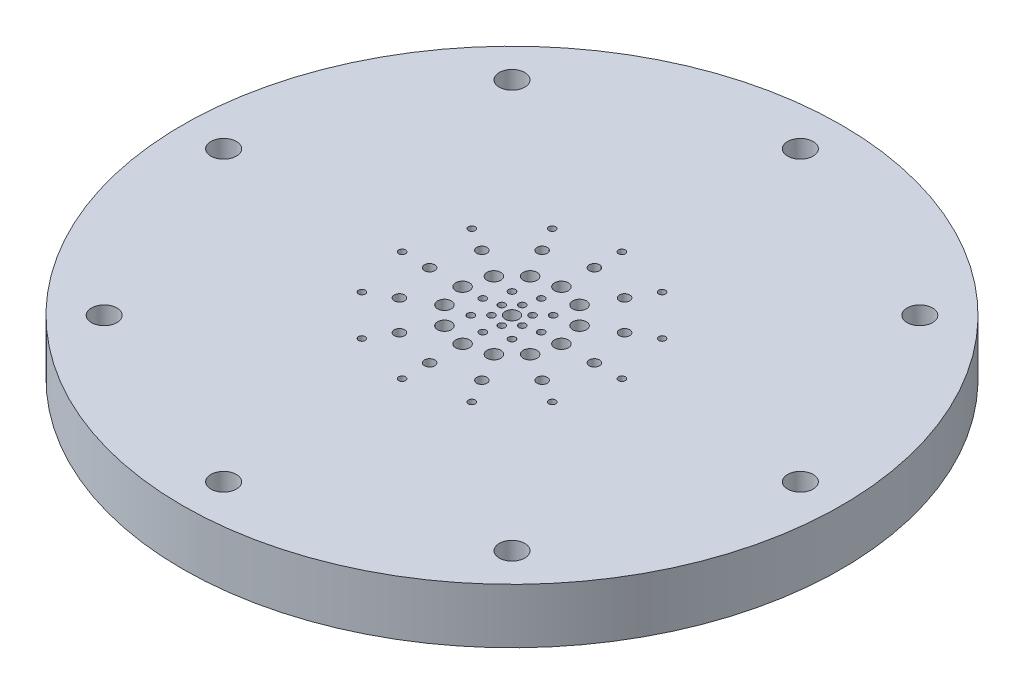
from build123d import *

# Parameters (mm, degrees)
SKETCH1_R                                      = 38.1
BOSS_EXTRUDE1_DEPTH                            = 6.35
CBORE_FOR_4_BUTTON_HEAD_CAP_SCREW1_D           = 2.9464
CBORE_FOR_4_BUTTON_HEAD_CAP_SCREW1_CBORE_D     = 4.826
CBORE_FOR_4_BUTTON_HEAD_CAP_SCREW1_CBORE_DEPTH = 2.8448
CIRPATTERN1_COUNT                              = 8
SKETCH7_R                                      = 0.3937
SKETCH7_R_2                                    = 0.5969
SKETCH7_R_3                                    = 0.8001
SKETCH7_R_4                                    = 0.79375
CUT_EXTRUDE1_DEPTH                             = 55.254423783
CIRPATTERN3_COUNT                              = 12
CUT_EXTRUDE3_REACH                             = 56.254
SKETCH8_R                                      = 0.396875
CUT_EXTRUDE4_REACH                             = 56.254
SKETCH9_R                                      = 0.396875


with BuildPart() as part:
    # Sketch1 → Boss-Extrude1 (new body)
    with BuildSketch(Plane(origin=(0, 0, 0), x_dir=(1, 0, 0), z_dir=(0, 1, 0))):
        Circle(SKETCH1_R)
    extrude(amount=BOSS_EXTRUDE1_DEPTH)

    # CBORE for #4 Button Head Cap Screw1 (through all)
    with Locations(Plane(origin=(0, 0, 0), x_dir=(-1, 0, 0), z_dir=(0, -1, 0))):
        with Locations((0, -33.3375)):
            cbore_for_4_button_head_cap_screw1 = CounterBoreHole(CBORE_FOR_4_BUTTON_HEAD_CAP_SCREW1_D / 2, CBORE_FOR_4_BUTTON_HEAD_CAP_SCREW1_CBORE_D / 2, CBORE_FOR_4_BUTTON_HEAD_CAP_SCREW1_CBORE_DEPTH)

    # CirPattern1: CBORE for #4 Button Head Cap Screw1 ×8 about axis
    cirpattern1_axis = Axis((0, 0, 0), (0, 1, 0))
    for i in range(1, CIRPATTERN1_COUNT):
        add(cbore_for_4_button_head_cap_screw1.rotate(cirpattern1_axis, i * 360 / CIRPATTERN1_COUNT), mode=Mode.SUBTRACT)

    # Sketch7 → Cut-Extrude1 (cut, through all)
    with BuildSketch(Plane.XZ):
        with Locations((0, 12.7)):
            Circle(SKETCH7_R)
        with Locations((0, 9.525)):
            Circle(SKETCH7_R_2)
        with Locations((0, 5.715)):
            Circle(SKETCH7_R_3)
        Circle(SKETCH7_R_4)
    cut_extrude1 = extrude(amount=-CUT_EXTRUDE1_DEPTH, mode=Mode.SUBTRACT)

    # CirPattern3: Cut-Extrude1 ×12 about axis
    cirpattern3_axis = Axis((0, 0, 0), (0, 1, 0))
    for i in range(1, CIRPATTERN3_COUNT):
        add(cut_extrude1.rotate(cirpattern3_axis, i * 360 / CIRPATTERN3_COUNT), mode=Mode.SUBTRACT)

    # Sketch8 → Cut-Extrude3 (cut, up to next)
    with BuildSketch(Plane(origin=(0, 6.35, 0), x_dir=(1, 0, 0), z_dir=(0, 1, 0)), mode=Mode.PRIVATE) as cut_extrude3_sk1:
        with Locations((3.368817958, 0)):
            Circle(SKETCH8_R)
    cut_extrude3_tool1 = extrude(cut_extrude3_sk1.sketch, amount=-CUT_EXTRUDE3_REACH, mode=Mode.PRIVATE) & part.part
    # Sketch8 → Cut-Extrude3 (cut, up to next)
    with BuildSketch(Plane(origin=(0, 6.35, 0), x_dir=(1, 0, 0), z_dir=(0, 1, 0)), mode=Mode.PRIVATE) as cut_extrude3_sk2:
        with Locations((2.382114023, -2.382114023)):
            Circle(SKETCH8_R)
    cut_extrude3_tool2 = extrude(cut_extrude3_sk2.sketch, amount=-CUT_EXTRUDE3_REACH, mode=Mode.PRIVATE) & part.part
    # Sketch8 → Cut-Extrude3 (cut, up to next)
    with BuildSketch(Plane(origin=(0, 6.35, 0), x_dir=(1, 0, 0), z_dir=(0, 1, 0)), mode=Mode.PRIVATE) as cut_extrude3_sk3:
        with Locations((0, -3.368817958)):
            Circle(SKETCH8_R)
    cut_extrude3_tool3 = extrude(cut_extrude3_sk3.sketch, amount=-CUT_EXTRUDE3_REACH, mode=Mode.PRIVATE) & part.part
    # Sketch8 → Cut-Extrude3 (cut, up to next)
    with BuildSketch(Plane(origin=(0, 6.35, 0), x_dir=(1, 0, 0), z_dir=(0, 1, 0)), mode=Mode.PRIVATE) as cut_extrude3_sk4:
        with Locations((-2.382114023, -2.382114023)):
            Circle(SKETCH8_R)
    cut_extrude3_tool4 = extrude(cut_extrude3_sk4.sketch, amount=-CUT_EXTRUDE3_REACH, mode=Mode.PRIVATE) & part.part
    # Sketch8 → Cut-Extrude3 (cut, up to next)
    with BuildSketch(Plane(origin=(0, 6.35, 0), x_dir=(1, 0, 0), z_dir=(0, 1, 0)), mode=Mode.PRIVATE) as cut_extrude3_sk5:
        with Locations((-3.368817958, 0)):
            Circle(SKETCH8_R)
    cut_extrude3_tool5 = extrude(cut_extrude3_sk5.sketch, amount=-CUT_EXTRUDE3_REACH, mode=Mode.PRIVATE) & part.part
    # Sketch8 → Cut-Extrude3 (cut, up to next)
    with BuildSketch(Plane(origin=(0, 6.35, 0), x_dir=(1, 0, 0), z_dir=(0, 1, 0)), mode=Mode.PRIVATE) as cut_extrude3_sk6:
        with Locations((-2.382114023, 2.382114023)):
            Circle(SKETCH8_R)
    cut_extrude3_tool6 = extrude(cut_extrude3_sk6.sketch, amount=-CUT_EXTRUDE3_REACH, mode=Mode.PRIVATE) & part.part
    # Sketch8 → Cut-Extrude3 (cut, up to next)
    with BuildSketch(Plane(origin=(0, 6.35, 0), x_dir=(1, 0, 0), z_dir=(0, 1, 0)), mode=Mode.PRIVATE) as cut_extrude3_sk7:
        with Locations((0, 3.368817958)):
            Circle(SKETCH8_R)
    cut_extrude3_tool7 = extrude(cut_extrude3_sk7.sketch, amount=-CUT_EXTRUDE3_REACH, mode=Mode.PRIVATE) & part.part
    # Sketch8 → Cut-Extrude3 (cut, up to next)
    with BuildSketch(Plane(origin=(0, 6.35, 0), x_dir=(1, 0, 0), z_dir=(0, 1, 0)), mode=Mode.PRIVATE) as cut_extrude3_sk8:
        with Locations((2.382114023, 2.382114023)):
            Circle(SKETCH8_R)
    cut_extrude3_tool8 = extrude(cut_extrude3_sk8.sketch, amount=-CUT_EXTRUDE3_REACH, mode=Mode.PRIVATE) & part.part
    add(cut_extrude3_tool1.solids().sort_by_distance((3.368818, 6.35, 0))[0], mode=Mode.SUBTRACT)
    add(cut_extrude3_tool2.solids().sort_by_distance((2.382114, 6.35, 2.382114))[0], mode=Mode.SUBTRACT)
    add(cut_extrude3_tool3.solids().sort_by_distance((0, 6.35, 3.368818))[0], mode=Mode.SUBTRACT)
    add(cut_extrude3_tool4.solids().sort_by_distance((-2.382114, 6.35, 2.382114))[0], mode=Mode.SUBTRACT)
    add(cut_extrude3_tool5.solids().sort_by_distance((-3.368818, 6.35, 0))[0], mode=Mode.SUBTRACT)
    add(cut_extrude3_tool6.solids().sort_by_distance((-2.382114, 6.35, -2.382114))[0], mode=Mode.SUBTRACT)
    add(cut_extrude3_tool7.solids().sort_by_distance((0, 6.35, -3.368818))[0], mode=Mode.SUBTRACT)
    add(cut_extrude3_tool8.solids().sort_by_distance((2.382114, 6.35, -2.382114))[0], mode=Mode.SUBTRACT)

    # Sketch9 → Cut-Extrude4 (cut, up to next)
    with BuildSketch(Plane(origin=(0, 6.35, 0), x_dir=(1, 0, 0), z_dir=(0, 1, 0)), mode=Mode.PRIVATE) as cut_extrude4_sk1:
        with Locations((1.187739958, 1.187739958)):
            Circle(SKETCH9_R)
    cut_extrude4_tool1 = extrude(cut_extrude4_sk1.sketch, amount=-CUT_EXTRUDE4_REACH, mode=Mode.PRIVATE) & part.part
    # Sketch9 → Cut-Extrude4 (cut, up to next)
    with BuildSketch(Plane(origin=(0, 6.35, 0), x_dir=(1, 0, 0), z_dir=(0, 1, 0)), mode=Mode.PRIVATE) as cut_extrude4_sk2:
        with Locations((1.622482956, -0.434742998)):
            Circle(SKETCH9_R)
    cut_extrude4_tool2 = extrude(cut_extrude4_sk2.sketch, amount=-CUT_EXTRUDE4_REACH, mode=Mode.PRIVATE) & part.part
    # Sketch9 → Cut-Extrude4 (cut, up to next)
    with BuildSketch(Plane(origin=(0, 6.35, 0), x_dir=(1, 0, 0), z_dir=(0, 1, 0)), mode=Mode.PRIVATE) as cut_extrude4_sk3:
        with Locations((0.434742998, -1.622482956)):
            Circle(SKETCH9_R)
    cut_extrude4_tool3 = extrude(cut_extrude4_sk3.sketch, amount=-CUT_EXTRUDE4_REACH, mode=Mode.PRIVATE) & part.part
    # Sketch9 → Cut-Extrude4 (cut, up to next)
    with BuildSketch(Plane(origin=(0, 6.35, 0), x_dir=(1, 0, 0), z_dir=(0, 1, 0)), mode=Mode.PRIVATE) as cut_extrude4_sk4:
        with Locations((-1.187739958, -1.187739958)):
            Circle(SKETCH9_R)
    cut_extrude4_tool4 = extrude(cut_extrude4_sk4.sketch, amount=-CUT_EXTRUDE4_REACH, mode=Mode.PRIVATE) & part.part
    # Sketch9 → Cut-Extrude4 (cut, up to next)
    with BuildSketch(Plane(origin=(0, 6.35, 0), x_dir=(1, 0, 0), z_dir=(0, 1, 0)), mode=Mode.PRIVATE) as cut_extrude4_sk5:
        with Locations((-1.622482956, 0.434742998)):
            Circle(SKETCH9_R)
    cut_extrude4_tool5 = extrude(cut_extrude4_sk5.sketch, amount=-CUT_EXTRUDE4_REACH, mode=Mode.PRIVATE) & part.part
    # Sketch9 → Cut-Extrude4 (cut, up to next)
    with BuildSketch(Plane(origin=(0, 6.35, 0), x_dir=(1, 0, 0), z_dir=(0, 1, 0)), mode=Mode.PRIVATE) as cut_extrude4_sk6:
        with Locations((-0.434742998, 1.622482956)):
            Circle(SKETCH9_R)
    cut_extrude4_tool6 = extrude(cut_extrude4_sk6.sketch, amount=-CUT_EXTRUDE4_REACH, mode=Mode.PRIVATE) & part.part
    add(cut_extrude4_tool1.solids().sort_by_distance((1.18774, 6.35, -1.18774))[0], mode=Mode.SUBTRACT)
    add(cut_extrude4_tool2.solids().sort_by_distance((1.622483, 6.35, 0.434743))[0], mode=Mode.SUBTRACT)
    add(cut_extrude4_tool3.solids().sort_by_distance((0.434743, 6.35, 1.622483))[0], mode=Mode.SUBTRACT)
    add(cut_extrude4_tool4.solids().sort_by_distance((-1.18774, 6.35, 1.18774))[0], mode=Mode.SUBTRACT)
    add(cut_extrude4_tool5.solids().sort_by_distance((-1.622483, 6.35, -0.434743))[0], mode=Mode.SUBTRACT)
    add(cut_extrude4_tool6.solids().sort_by_distance((-0.434743, 6.35, -1.622483))[0], mode=Mode.SUBTRACT)


solid = part.part
